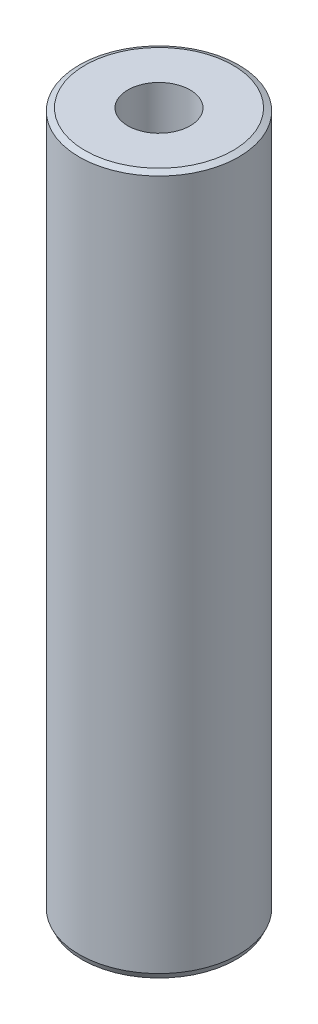
from build123d import *
from OCP.BRepFilletAPI import BRepFilletAPI_MakeChamfer

# Parameters (mm, degrees)
SKETCH1_R           = 10
BOSS_EXTRUDE1_DEPTH = 87.676668009
SKETCH2_R           = 3.906742916
CUT_EXTRUDE1_DEPTH  = 89.809898734
CHAMFER1_SIZE       = 0.339879733
CHAMFER1_SIZE2      = 0.723548102


with BuildPart() as part:
    # Sketch1 → Boss-Extrude1 (new body)
    with BuildSketch(Plane(origin=(0, 0, 0), x_dir=(1, 0, 0), z_dir=(0, 1, 0))):
        Circle(SKETCH1_R)
    extrude(amount=BOSS_EXTRUDE1_DEPTH)

    # Sketch2 → Cut-Extrude1 (cut, through all)
    with BuildSketch(Plane(origin=(0, 0, 0), x_dir=(1, 0, 0), z_dir=(0, 1, 0))):
        Circle(SKETCH2_R)
    extrude(amount=CUT_EXTRUDE1_DEPTH, mode=Mode.SUBTRACT)

    # Chamfer1: one chamfer whose edges measure the first distance from different faces: ONE call of the kernel's chamfer builder (chamfer() names one face for all edges)
    chamfer1_edges_1 = [part.edges().sort_by_distance(p)[0] for p in [
        (-10, 87.676668009, 0),
    ]]
    chamfer1_side_1 = [part.faces().sort_by_distance(p)[0] for p in [
        (-10, 43.838334004, 0),
    ]]
    chamfer1_edges_2 = [part.edges().sort_by_distance(p)[0] for p in [
        (-10, 0, 0),
    ]]
    chamfer1_side_2 = [part.faces().sort_by_distance(p)[0] for p in [
        (-9.717157288, 0, 0),
    ]]
    chamfer1 = BRepFilletAPI_MakeChamfer(part.part.solid().wrapped)
    for e in chamfer1_edges_1:
        chamfer1.Add(CHAMFER1_SIZE, CHAMFER1_SIZE2, e.wrapped, chamfer1_side_1[0].wrapped)  # the first distance lies on this face
    for e in chamfer1_edges_2:
        chamfer1.Add(CHAMFER1_SIZE, CHAMFER1_SIZE2, e.wrapped, chamfer1_side_2[0].wrapped)  # the first distance lies on this face
    add(Compound.cast(chamfer1.Shape()), mode=Mode.REPLACE)


solid = part.part
